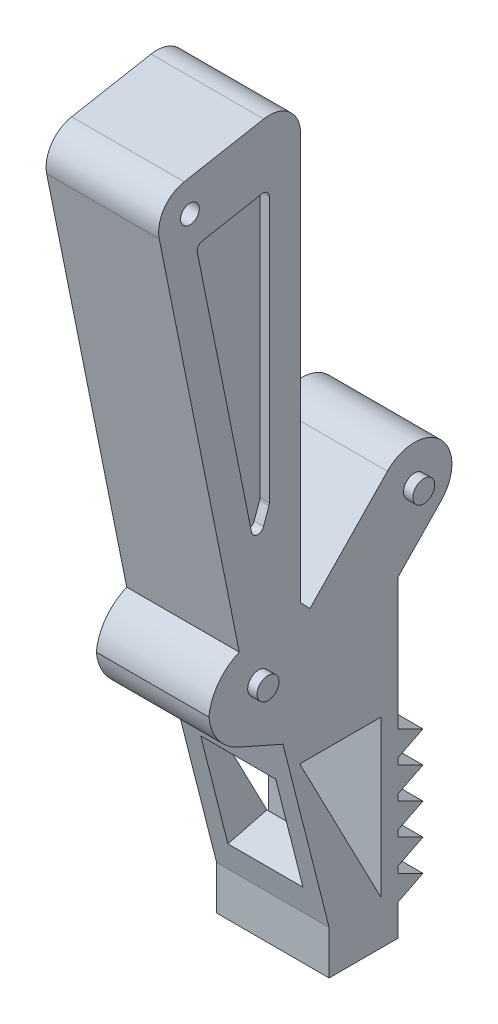
from build123d import *

# Parameters (mm, degrees)
BOSS_EXTRUDE1_DEPTH = 9
CUT_EXTRUDE1_DEPTH  = 25
BOSS_EXTRUDE2_DEPTH = 18
LPATTERN1_COUNT     = 5
LPATTERN1_PITCH     = 5
FILLET2_R           = 8
FILLET3_R           = 5
SKETCH7_R           = 1.5
CUT_EXTRUDE2_DEPTH  = 25
SKETCH8_W           = 12
SKETCH8_H           = 17.678618226
CUT_EXTRUDE4_DEPTH  = 8
SKETCH10_R          = 1.75
BOSS_EXTRUDE3_DEPTH = 1.5
SKETCH11_R          = 1.75
BOSS_EXTRUDE5_DEPTH = 1.5
CUT_EXTRUDE5_DEPTH  = 1.5


with BuildPart() as part:
    # Sketch4 → Boss-Extrude1 (new, symmetric)
    with BuildSketch(Plane(origin=(0, 0, 0), x_dir=(0, 0, -1), z_dir=(1, 0, 0))):
        Polygon((110.796991994, 3.426984131), (100.993233908, 1.455607104), (87.193594717, 70.081913709), (110.796991994, 74.426984131), align=None)
        Polygon((126.36598388, -0.864331166), (133.316653042, 6.325119314), (124.689312466, 14.665922308), (112.285585973, 1.836081711), (110.796991994, 3.426984131), (100.993233908, 1.455607104), (96.091354865, 0.469918591), (96.091354865, -9.530081409), (107.980804376, -14.787551363), (115.36598388, -43.864331166), (115.36598388, -50.864331166), (126.36598388, -50.864331166), align=None)
        with BuildLine():
            Line((133.316653042, 6.325119314), (124.689312466, 14.665922308))
            ThreePointArc((124.689312466, 14.665922308), (133.173384251, 14.809191099), (133.316653042, 6.325119314))
        make_face()
    extrude(amount=BOSS_EXTRUDE1_DEPTH, both=True)

    # Sketch5 → Cut-Extrude1 (cut)
    with BuildSketch(Plane(origin=(9, 0, 0), x_dir=(0, 0, -1), z_dir=(1, 0, 0))):
        Polygon((123.66598388, -43.864331166), (123.66598388, -18.864331166), (110.66598388, -18.864331166), align=None)
    extrude(amount=-CUT_EXTRUDE1_DEPTH, mode=Mode.SUBTRACT)

    # Sketch6 → Boss-Extrude2 (add)
    with BuildSketch(Plane(origin=(9, 0, 0), x_dir=(0, 0, -1), z_dir=(1, 0, 0))):
        Polygon((126.36598388, -43.864331166), (130.36598388, -43.864331166), (126.36598388, -41.864331166), align=None)
        Polygon((126.36598388, -43.864331166), (126.36598388, -45.864331166), (130.36598388, -43.864331166), align=None)
    boss_extrude2 = extrude(amount=-BOSS_EXTRUDE2_DEPTH)

    # LPattern1: Boss-Extrude2 ×5
    with Locations(*[(0, i * LPATTERN1_PITCH, 0) for i in range(1, LPATTERN1_COUNT)]):
        add(boss_extrude2)

    # Fillet2
    # the kernel refuses this fillet: 8 mm, written as the material it takes off along each edge
    with BuildSketch(Plane(origin=(-22.024202742, -9.530081409, -96.091354865), x_dir=(0, -0.4044207656516306, -0.9145730393521061), z_dir=(1, 0, 0))) as fillet2_piece_1:
        with BuildLine():
            CenterArc((FILLET2_R * 0.651210137104, FILLET2_R), FILLET2_R, 203.854834431, 66.145165569)
            Line((-FILLET2_R * 0.263362902248, FILLET2_R * 0.595579234348), (-FILLET2_R * 0.281654363035, FILLET2_R * 0.587490819035))
            Line((-FILLET2_R * 0.281654363035, FILLET2_R * 0.587490819035), (-FILLET2_R * 0.0130242027421, -FILLET2_R * 0.02))
            Line((-FILLET2_R * 0.0130242027421, -FILLET2_R * 0.02), (FILLET2_R * 0.651210137104, -FILLET2_R * 0.02))
            Line((FILLET2_R * 0.651210137104, -FILLET2_R * 0.02), (FILLET2_R * 0.651210137104, 0))
        make_face()
    extrude(amount=44.048405484, mode=Mode.SUBTRACT)
    with BuildSketch(Plane(origin=(-24.975146678, 0.469918591, -96.091354865), x_dir=(0, -1, 0), z_dir=(1, 0, 0))) as fillet2_piece_2:
        with BuildLine():
            CenterArc((6.390058671, 8), FILLET2_R, 202.784433835, 67.215566165)
            Line((-0.985688514, 4.901879043), (-1.133203457, 4.839916624))
            ThreePointArc((-1.133203457, 4.839916624), (-0.649704386, 2.419397489), (-0.156860129, -0.031542032))
            Line((-0.156860129, -0.031542032), (0, -0.16))
            Line((0, -0.16), (6.390058671, -0.16))
            Line((6.390058671, -0.16), (6.390058671, 0))
        make_face()
    extrude(amount=49.950293357, mode=Mode.SUBTRACT)

    # Fillet3
    fillet3_edges = [part.edges().sort_by_distance(p)[0] for p in [
        (0, 70.081913709, -87.193594717),
        (0, 74.426984131, -110.796991994),
    ]]
    fillet(fillet3_edges, radius=FILLET3_R)

    # Sketch7 → Cut-Extrude2 (cut)
    with BuildSketch(Plane(origin=(9, 0, 0), x_dir=(0, 0, -1), z_dir=(1, 0, 0))):
        with Locations((93.097450529, 66.084720863)):
            Circle(SKETCH7_R)
    extrude(amount=-CUT_EXTRUDE2_DEPTH, mode=Mode.SUBTRACT)

    # Sketch8 → Cut-Extrude4 (cut)
    with BuildSketch(Plane(origin=(0, 24.86774856, -97.908798117), x_dir=(1, 0, 0), z_dir=(0, -0.246172650114547, 0.9692259934275292))):
        with Locations((0, -57.253709048)):
            Rectangle(SKETCH8_W, SKETCH8_H)
    extrude(amount=-CUT_EXTRUDE4_DEPTH, mode=Mode.SUBTRACT)

    # Sketch10 → Boss-Extrude3 (add)
    with BuildSketch(Plane(origin=(9, 0, 0), x_dir=(0, 0, -1), z_dir=(1, 0, 0))):
        with Locations((129.002982754, 10.495520811)):
            Circle(SKETCH10_R)
    boss_extrude3 = extrude(amount=BOSS_EXTRUDE3_DEPTH)

    # Sketch11 → Boss-Extrude5 (add)
    with BuildSketch(Plane(origin=(9, 0, 0), x_dir=(0, 0, -1), z_dir=(1, 0, 0))):
        with Locations((104.091354865, -4.320400313)):
            Circle(SKETCH11_R)
    boss_extrude5 = extrude(amount=BOSS_EXTRUDE5_DEPTH)

    # Sketch12 → Cut-Extrude5 (cut)
    with BuildSketch(Plane(origin=(9, 0, 0), x_dir=(0, 0, -1), z_dir=(1, 0, 0))):
        with BuildLine():
            Line((105.796991994, 62.137633614), (105.796991994, 19.67893978))
            ThreePointArc((105.796991994, 19.67893978), (105.782233847, 19.507771757), (105.73839501, 19.341655979))
            Line((105.73839501, 19.341655979), (104.874938008, 16.931635031))
            ThreePointArc((104.874938008, 16.931635031), (103.860802938, 16.271567315), (102.953159184, 17.071781129))
            Line((102.953159184, 17.071781129), (94.283666788, 60.185607156))
            ThreePointArc((94.283666788, 60.185607156), (94.435981087, 60.943382118), (95.082997995, 61.366219745))
            Line((95.082997995, 61.366219745), (104.615947394, 63.121108501))
            ThreePointArc((104.615947394, 63.121108501), (105.43689644, 62.906088102), (105.796991994, 62.137633614))
        make_face()
    cut_extrude5 = extrude(amount=-CUT_EXTRUDE5_DEPTH, mode=Mode.SUBTRACT)

    # Mirror1: Boss-Extrude3, Boss-Extrude5, Cut-Extrude5 across plane
    add(boss_extrude3.mirror(Plane(origin=(0, 0, 0), x_dir=(0, 0, 1), z_dir=(1, 0, 0))))
    add(boss_extrude5.mirror(Plane(origin=(0, 0, 0), x_dir=(0, 0, 1), z_dir=(1, 0, 0))))
    add(cut_extrude5.mirror(Plane(origin=(0, 0, 0), x_dir=(0, 0, 1), z_dir=(1, 0, 0))), mode=Mode.SUBTRACT)


solid = part.part
